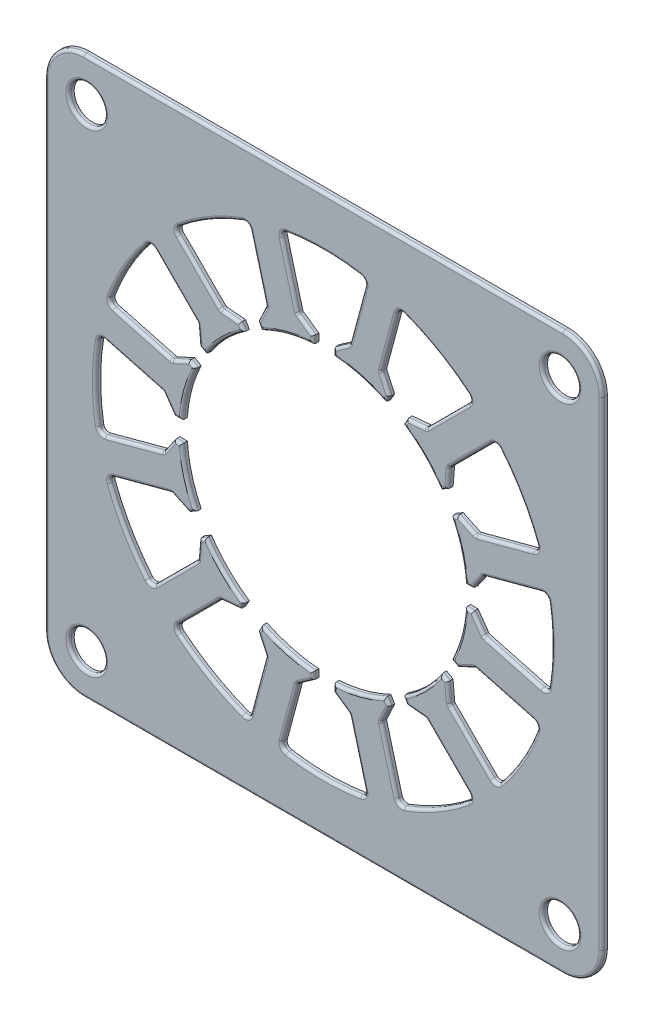
from build123d import *

# Parameters (mm, degrees)
SKETCH1_W                              = 100
SKETCH1_H                              = 100
SKETCH1_R                              = 25.5
LAMINATION_EXTRUCTION_DEPTH            = 1
SLOT_CUT_DEPTH                         = 71.717748833
SLOT_FILLET_TOP_R                      = 1
SLOT_FILLET_BOTTOM_R                   = 0.5
SLOT_DUPLICATE_COUNT                   = 12
SLOT_FILLET_TOP_OF_SLOT_DUPLICATE_R    = 1
SLOT_FILLET_BOTTOM_OF_SLOT_DUPLICATE_R = 0.5
SKETCH3_R                              = 3.25
BOLT_HOLE_CUT_DEPTH                    = 71.717748833
CORNER_FILLET_R                        = 7
FILLET1_R                              = 0.5


with BuildPart() as part:
    # Sketch1 → Lamination Extruction (new body)
    with BuildSketch(Plane.XY):
        Rectangle(SKETCH1_W, SKETCH1_H)
        Circle(SKETCH1_R, mode=Mode.SUBTRACT)
    extrude(amount=LAMINATION_EXTRUCTION_DEPTH)

    # Sketch2 → Slot Cut (cut, through all)
    with BuildSketch(Plane.XY.offset(1)):
        with BuildLine():
            Line((4.673479277, 28.779136449), (7.75, 40.260868098))
            ThreePointArc((7.75, 40.260868098), (0, 41), (-7.75, 40.260868098))
            Line((-7.75, 40.260868098), (-4.673479277, 28.779136449))
            Line((-4.673479277, 28.779136449), (-1.825, 26.784609787))
            Line((-1.825, 26.784609787), (-1.825, 25.434609787))
            ThreePointArc((-1.825, 25.434609787), (0, 25.5), (1.825, 25.434609787))
            Line((1.825, 25.434609787), (1.825, 26.784609787))
            Line((1.825, 26.784609787), (4.673479277, 28.779136449))
        make_face()
    slot_cut = extrude(amount=-SLOT_CUT_DEPTH, mode=Mode.SUBTRACT)

    # Slot Fillet Top
    slot_fillet_top_edges = [part.edges().sort_by_distance(p)[0] for p in [
        (7.75, 40.260868098, 0.5),
        (-7.75, 40.260868098, 0.5),
    ]]
    fillet(slot_fillet_top_edges, radius=SLOT_FILLET_TOP_R)

    # Slot Fillet Bottom
    slot_fillet_bottom_edges = [part.edges().sort_by_distance(p)[0] for p in [
        (4.673479277, 28.779136449, 0.5),
        (-4.673479277, 28.779136449, 0.5),
    ]]
    fillet(slot_fillet_bottom_edges, radius=SLOT_FILLET_BOTTOM_R)

    # Slot Duplicate: Slot Cut ×12 about axis
    slot_duplicate_axis = Axis((0, 0, 1), (0, 0, -1))
    for i in range(1, SLOT_DUPLICATE_COUNT):
        add(slot_cut.rotate(slot_duplicate_axis, i * 360 / SLOT_DUPLICATE_COUNT), mode=Mode.SUBTRACT)

    # Slot Fillet Top of Slot Duplicate
    slot_fillet_top_of_slot_duplicate_edges = [part.edges().sort_by_distance(p)[0] for p in [
        (26.842130928, 30.991934551, 0.5),
        (13.41873717, 38.741934551, 0.5),
        (38.741934551, 13.41873717, 0.5),
        (30.991934551, 26.842130928, 0.5),
        (40.260868098, -7.75, 0.5),
        (40.260868098, 7.75, 0.5),
        (30.991934551, -26.842130928, 0.5),
        (38.741934551, -13.41873717, 0.5),
        (13.41873717, -38.741934551, 0.5),
        (26.842130928, -30.991934551, 0.5),
        (-7.75, -40.260868098, 0.5),
        (7.75, -40.260868098, 0.5),
        (-26.842130928, -30.991934551, 0.5),
        (-13.41873717, -38.741934551, 0.5),
        (-38.741934551, -13.41873717, 0.5),
        (-30.991934551, -26.842130928, 0.5),
        (-40.260868098, 7.75, 0.5),
        (-40.260868098, -7.75, 0.5),
        (-30.991934551, 26.842130928, 0.5),
        (-38.741934551, 13.41873717, 0.5),
        (-13.41873717, 38.741934551, 0.5),
        (-26.842130928, 30.991934551, 0.5),
    ]]
    fillet(slot_fillet_top_of_slot_duplicate_edges, radius=SLOT_FILLET_TOP_OF_SLOT_DUPLICATE_R)

    # Slot Fillet Bottom of Slot Duplicate
    slot_fillet_bottom_of_slot_duplicate_edges = [part.edges().sort_by_distance(p)[0] for p in [
        (18.436920002, 22.586723625, 0.5),
        (10.342216447, 27.260202902, 0.5),
        (27.260202902, 10.342216447, 0.5),
        (22.586723625, 18.436920002, 0.5),
        (28.779136449, -4.673479277, 0.5),
        (28.779136449, 4.673479277, 0.5),
        (22.586723625, -18.436920002, 0.5),
        (27.260202902, -10.342216447, 0.5),
        (10.342216447, -27.260202902, 0.5),
        (18.436920002, -22.586723625, 0.5),
        (-4.673479277, -28.779136449, 0.5),
        (4.673479277, -28.779136449, 0.5),
        (-18.436920002, -22.586723625, 0.5),
        (-10.342216447, -27.260202902, 0.5),
        (-27.260202902, -10.342216447, 0.5),
        (-22.586723625, -18.436920002, 0.5),
        (-28.779136449, 4.673479277, 0.5),
        (-28.779136449, -4.673479277, 0.5),
        (-22.586723625, 18.436920002, 0.5),
        (-27.260202902, 10.342216447, 0.5),
        (-10.342216447, 27.260202902, 0.5),
        (-18.436920002, 22.586723625, 0.5),
    ]]
    fillet(slot_fillet_bottom_of_slot_duplicate_edges, radius=SLOT_FILLET_BOTTOM_OF_SLOT_DUPLICATE_R)

    # Sketch3 → Bolt Hole Cut (cut, through all)
    with BuildSketch(Plane.XY.offset(1)):
        with Locations((-42.5, 42.5)):
            Circle(SKETCH3_R)
        with Locations((42.5, 42.5)):
            Circle(SKETCH3_R)
        with Locations((42.5, -42.5)):
            Circle(SKETCH3_R)
        with Locations((-42.5, -42.5)):
            Circle(SKETCH3_R)
    extrude(amount=-BOLT_HOLE_CUT_DEPTH, mode=Mode.SUBTRACT)

    # Corner Fillet
    corner_fillet_edges = [part.edges().sort_by_distance(p)[0] for p in [
        (-50, 50, 0.5),
        (-50, -50, 0.5),
        (50, -50, 0.5),
        (50, 50, 0.5),
    ]]
    fillet(corner_fillet_edges, radius=CORNER_FILLET_R)

    # Fillet1
    fillet1_edges = [part.edges().sort_by_distance(p)[0] for p in [
        (38.320991203, 13.64610464, 1),
        (35.507041555, 20.5, 1),
        (30.978368882, 26.36389956, 1),
        (26.468714741, 22.318911118, 1),
        (22.615806033, 18.423358653, 1),
        (22.427257541, 16.614214324, 1),
        (18.03122292, 18.03122292, 1),
        (16.614214324, 22.427257541, 1),
        (18.423358653, 22.615806033, 1),
        (22.318911118, 26.468714741, 1),
        (26.36389956, 30.978368882, 1),
        (20.5, 35.507041555, 1),
        (13.64610464, 38.320991203, 1),
        (11.763123812, 32.563101384, 1),
        (10.374183225, 27.262999633, 1),
        (11.115467606, 25.601960439, 1),
        (6.59988565, 24.63110857, 1),
        (3.174702898, 27.72968193, 1),
        (4.6471936, 28.797541878, 1),
        (6.094386643, 34.08203493, 1),
        (7.34262232, 40.0100042, 1),
        (0, 41, 1),
        (-7.34262232, 40.0100042, 1),
        (-6.094386643, 34.08203493, 1),
        (-4.6471936, 28.797541878, 1),
        (-3.174702898, 27.72968193, 1),
        (-6.59988565, 24.63110857, 1),
        (-11.115467606, 25.601960439, 1),
        (-10.374183225, 27.262999633, 1),
        (-11.763123812, 32.563101384, 1),
        (-13.64610464, 38.320991203, 1),
        (-20.5, 35.507041555, 1),
        (-26.36389956, 30.978368882, 1),
        (-22.318911118, 26.468714741, 1),
        (-18.423358653, 22.615806033, 1),
        (-16.614214324, 22.427257541, 1),
        (-18.03122292, 18.03122292, 1),
        (-22.427257541, 16.614214324, 1),
        (-22.615806033, 18.423358653, 1),
        (-26.468714741, 22.318911118, 1),
        (-30.978368882, 26.36389956, 1),
        (-35.507041555, 20.5, 1),
        (-38.320991203, 13.64610464, 1),
        (-32.563101384, 11.763123812, 1),
        (-27.262999633, 10.374183225, 1),
        (-25.601960439, 11.115467606, 1),
        (-24.63110857, 6.59988565, 1),
        (-27.72968193, 3.174702898, 1),
        (-28.797541878, 4.6471936, 1),
        (-34.08203493, 6.094386643, 1),
        (-40.0100042, 7.34262232, 1),
        (-41, 0, 1),
        (-40.0100042, -7.34262232, 1),
        (-34.08203493, -6.094386643, 1),
        (-28.797541878, -4.6471936, 1),
        (-27.72968193, -3.174702898, 1),
        (-24.63110857, -6.59988565, 1),
        (-25.601960439, -11.115467606, 1),
        (-27.262999633, -10.374183225, 1),
        (-32.563101384, -11.763123812, 1),
        (-38.320991203, -13.64610464, 1),
        (-35.507041555, -20.5, 1),
        (-30.978368882, -26.36389956, 1),
        (-26.468714741, -22.318911118, 1),
        (-22.615806033, -18.423358653, 1),
        (-22.427257541, -16.614214324, 1),
        (-18.03122292, -18.03122292, 1),
        (-16.614214324, -22.427257541, 1),
        (-18.423358653, -22.615806033, 1),
        (-22.318911118, -26.468714741, 1),
        (-26.36389956, -30.978368882, 1),
        (-20.5, -35.507041555, 1),
        (-13.64610464, -38.320991203, 1),
        (-11.763123812, -32.563101384, 1),
        (-10.374183225, -27.262999633, 1),
        (-11.115467606, -25.601960439, 1),
        (-6.59988565, -24.63110857, 1),
        (-3.174702898, -27.72968193, 1),
        (-4.6471936, -28.797541878, 1),
        (-6.094386643, -34.08203493, 1),
        (-7.34262232, -40.0100042, 1),
        (0, -41, 1),
        (7.34262232, -40.0100042, 1),
        (6.094386643, -34.08203493, 1),
        (4.6471936, -28.797541878, 1),
        (3.174702898, -27.72968193, 1),
        (6.59988565, -24.63110857, 1),
        (11.115467606, -25.601960439, 1),
        (10.374183225, -27.262999633, 1),
        (11.763123812, -32.563101384, 1),
        (13.64610464, -38.320991203, 1),
        (20.5, -35.507041555, 1),
        (26.36389956, -30.978368882, 1),
        (22.318911118, -26.468714741, 1),
        (18.423358653, -22.615806033, 1),
        (16.614214324, -22.427257541, 1),
        (18.03122292, -18.03122292, 1),
        (22.427257541, -16.614214324, 1),
        (22.615806033, -18.423358653, 1),
        (26.468714741, -22.318911118, 1),
        (30.978368882, -26.36389956, 1),
        (35.507041555, -20.5, 1),
        (38.320991203, -13.64610464, 1),
        (32.563101384, -11.763123812, 1),
        (27.262999633, -10.374183225, 1),
        (25.601960439, -11.115467606, 1),
        (24.63110857, -6.59988565, 1),
        (27.72968193, -3.174702898, 1),
        (28.797541878, -4.6471936, 1),
        (34.08203493, -6.094386643, 1),
        (40.0100042, -7.34262232, 1),
        (41, 0, 1),
        (40.0100042, 7.34262232, 1),
        (34.08203493, 6.094386643, 1),
        (28.797541878, 4.6471936, 1),
        (27.72968193, 3.174702898, 1),
        (24.63110857, 6.59988565, 1),
        (25.601960439, 11.115467606, 1),
        (27.262999633, 10.374183225, 1),
        (32.563101384, 11.763123812, 1),
        (47.949747468, 47.949747468, 1),
        (50, 0, 1),
        (47.949747468, -47.949747468, 1),
        (0, -50, 1),
        (-47.949747468, -47.949747468, 1),
        (-50, 0, 1),
        (-47.949747468, 47.949747468, 1),
        (0, 50, 1),
        (39.25, 42.5, 1),
        (-45.75, -42.5, 1),
        (39.25, -42.5, 1),
        (-45.75, 42.5, 1),
        (21.699085358, 14.635301255, 1),
        (14.635301255, 21.699085358, 1),
        (11.474308531, 23.524085358, 1),
        (1.825, 26.109609787, 1),
        (-1.825, 26.109609787, 1),
        (-11.474308531, 23.524085358, 1),
        (-14.635301255, 21.699085358, 1),
        (-21.699085358, 14.635301255, 1),
        (-23.524085358, 11.474308531, 1),
        (-26.109609787, 1.825, 1),
        (-26.109609787, -1.825, 1),
        (-23.524085358, -11.474308531, 1),
        (-21.699085358, -14.635301255, 1),
        (-14.635301255, -21.699085358, 1),
        (-11.474308531, -23.524085358, 1),
        (-1.825, -26.109609787, 1),
        (1.825, -26.109609787, 1),
        (11.474308531, -23.524085358, 1),
        (14.635301255, -21.699085358, 1),
        (21.699085358, -14.635301255, 1),
        (23.524085358, -11.474308531, 1),
        (26.109609787, -1.825, 1),
        (26.109609787, 1.825, 1),
        (23.524085358, 11.474308531, 1),
    ]]
    fillet(fillet1_edges, radius=FILLET1_R)


solid = part.part
